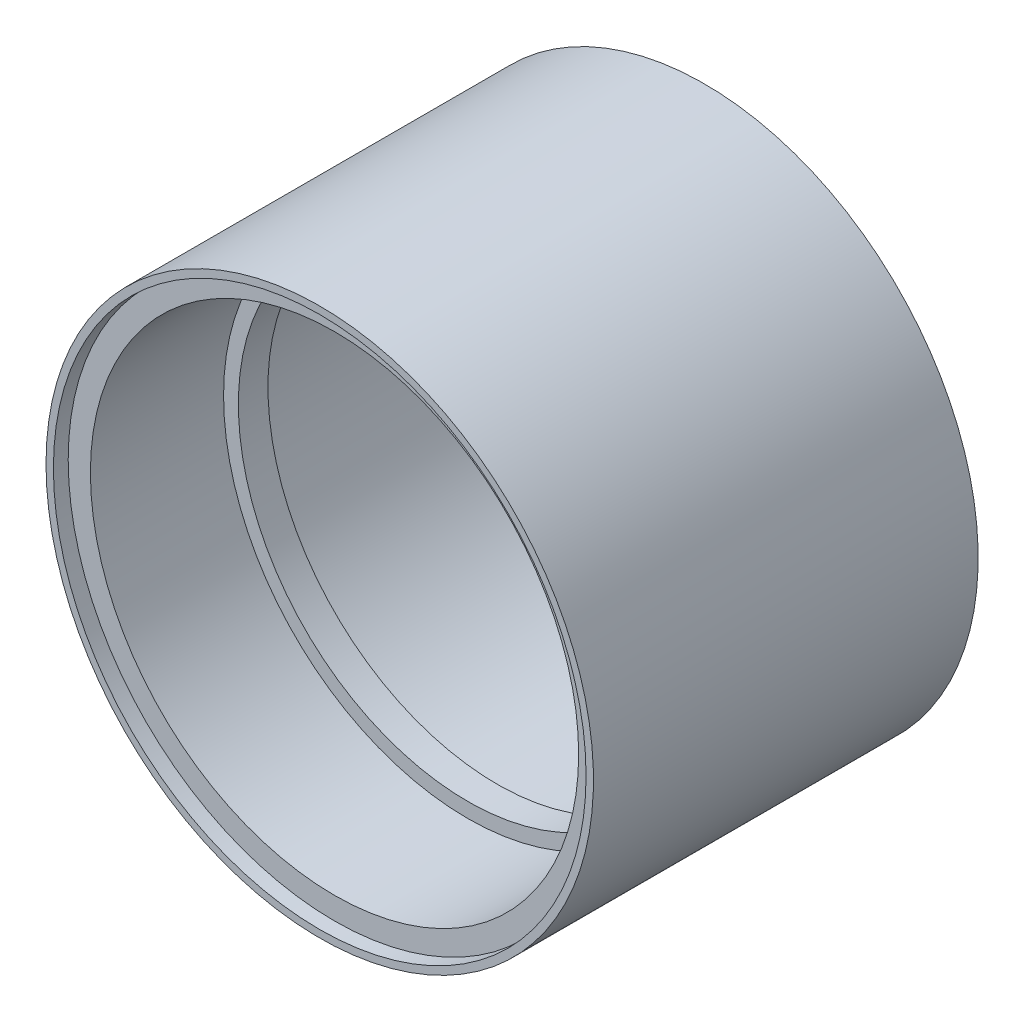
from build123d import *

# Parameters (mm, degrees)
SKETCH1_R           = 19
SKETCH1_R_2         = 13.5
BOSS_EXTRUDE1_DEPTH = 26
SKETCH2_W           = 26
SKETCH2_H           = 0.5


with BuildPart() as part:
    # Sketch1 → Boss-Extrude1 (new body)
    with BuildSketch(Plane.XY):
        Circle(SKETCH1_R)
        Circle(SKETCH1_R_2, mode=Mode.SUBTRACT)
    extrude(amount=BOSS_EXTRUDE1_DEPTH)

    # Sketch2 → Cut-Revolve1 (revolve, cut)
    with BuildSketch(Plane(origin=(0, 0, 0), x_dir=(0, 0, -1), z_dir=(1, 0, 0))):
        with Locations((-13, 18.75)):
            Rectangle(SKETCH2_W, SKETCH2_H)
    revolve(axis=Axis((0, 0, 0), (0, 0, 1)), mode=Mode.SUBTRACT)

    # Sketch3 → Cut-Revolve2 (revolve, cut)
    with BuildSketch(Plane(origin=(0, 0, 0), x_dir=(0, 0, -1), z_dir=(1, 0, 0))):
        Polygon((0, 18), (0, 0), (-26, 0), (-26, 18), (-25, 18), (-25, 16.5), (-16, 16.5), (-16, 15.5), (-14, 15.5), (-14, 16.5), (-1, 16.5), (-1, 18), align=None)
    revolve(axis=Axis((0, 0, 26), (0, 0, -1)), mode=Mode.SUBTRACT)


solid = part.part
